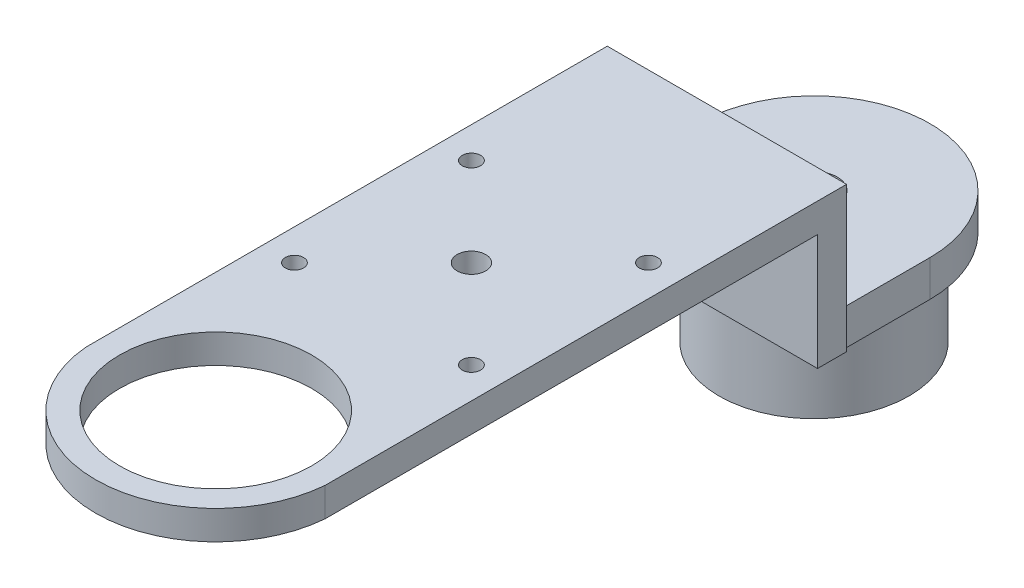
from build123d import *

# Parameters (mm, degrees)
SKETCH1_W           = 41.91
SKETCH1_H           = 120
BOSS_EXTRUDE1_DEPTH = 5.08
SKETCH2_W           = 41.91
SKETCH2_H           = 25.4
BOSS_EXTRUDE2_DEPTH = 5.08
BOSS_EXTRUDE3_DEPTH = 6.35
SKETCH7_R           = 2.5
SKETCH7_R_2         = 1.6
CUT_EXTRUDE1_DEPTH  = 105.79971585
SKETCH8_R           = 16.637
SKETCH8_R_2         = 11.43
BOSS_EXTRUDE4_DEPTH = 16.51
SKETCH9_R           = 4.09575
CUT_EXTRUDE2_DEPTH  = 106.902020955
SKETCH10_R          = 16.8275
CUT_EXTRUDE3_DEPTH  = 112.024889742


with BuildPart() as part:
    # Sketch1 → Boss-Extrude1 (new body)
    with BuildSketch(Plane(origin=(0, 0, 0), x_dir=(1, 0, 0), z_dir=(0, 1, 0))):
        Rectangle(SKETCH1_W, SKETCH1_H)
    extrude(amount=BOSS_EXTRUDE1_DEPTH)

    # Sketch2 → Boss-Extrude2 (add)
    with BuildSketch(Plane(origin=(0, 0, -60), x_dir=(-1, 0, 0), z_dir=(0, 0, -1))):
        with Locations((0, -7.62)):
            Rectangle(SKETCH2_W, SKETCH2_H)
    extrude(amount=BOSS_EXTRUDE2_DEPTH)

    # Sketch6 → Boss-Extrude3 (add)
    with BuildSketch(Plane.XZ.offset(20.32)):
        with BuildLine():
            Line((20.32, -80.3327), (20.32, -60.0127))
            Line((20.32, -60.0127), (-20.32, -60.0127))
            Line((-20.32, -60.0127), (-20.32, -80.3327))
            ThreePointArc((-20.32, -80.3327), (0, -100.6527), (20.32, -80.3327))
        make_face()
    extrude(amount=-BOSS_EXTRUDE3_DEPTH)

    # Sketch7 → Cut-Extrude1 (cut, through all)
    with BuildSketch(Plane.XZ):
        with Locations((0, -20.3327)):
            Circle(SKETCH7_R)
        with Locations((15.5, -35.8327)):
            Circle(SKETCH7_R_2)
        with Locations((-15.5, -35.8327)):
            Circle(SKETCH7_R_2)
        with Locations((-15.5, -4.8327)):
            Circle(SKETCH7_R_2)
        with Locations((15.5, -4.8327)):
            Circle(SKETCH7_R_2)
    extrude(amount=-CUT_EXTRUDE1_DEPTH, mode=Mode.SUBTRACT)

    # Sketch8 → Boss-Extrude4 (add)
    with BuildSketch(Plane.XZ.offset(20.32)):
        with Locations((0, -80.3327)):
            Circle(SKETCH8_R)
        with Locations((0, -80.3327)):
            Circle(SKETCH8_R_2, mode=Mode.SUBTRACT)
    extrude(amount=BOSS_EXTRUDE4_DEPTH)

    # Sketch9 → Cut-Extrude2 (cut, through all)
    with BuildSketch(Plane.XZ.offset(20.32)):
        with Locations((0, -80.3327)):
            Circle(SKETCH9_R)
    extrude(amount=-CUT_EXTRUDE2_DEPTH, mode=Mode.SUBTRACT)

    # Sketch10 → Cut-Extrude3 (cut, through all)
    with BuildSketch(Plane(origin=(0, 5.08, 0), x_dir=(-1, 0, 0), z_dir=(0, 1, 0))):
        with Locations((0, 24.4677)):
            Circle(SKETCH10_R)
        with BuildLine():
            Line((-20.955, 26.23326508), (-65.546860357, 51.874921236))
            Line((-65.546860357, 51.874921236), (-15.844946324, 69.797933797))
            Line((-15.844946324, 69.797933797), (48.51812644, 69.797933797))
            Line((48.51812644, 69.797933797), (38.772920655, 26.23326508))
            Line((38.772920655, 26.23326508), (20.955, 26.23326508))
            ThreePointArc((20.955, 26.23326508), (0, 45.496947372), (-20.955, 26.23326508))
        make_face()
    extrude(amount=-CUT_EXTRUDE3_DEPTH, mode=Mode.SUBTRACT)


solid = part.part
